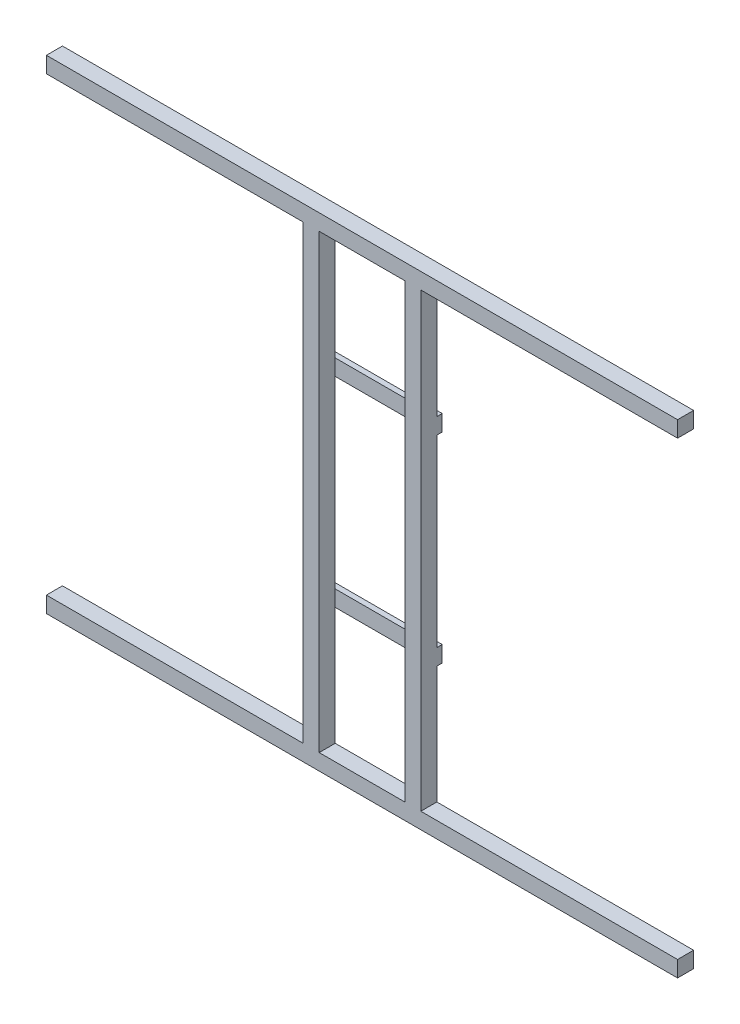
from build123d import *

# Parameters (mm, degrees)
SKETCH1_W        = 110
SKETCH1_H        = 15
EXTRUDE1_DEPTH   = 5
EXTRUDE1_2_DEPTH = 5
SKETCH2_W        = 80
SKETCH2_H        = 421.99984649
EXTRUDE2_DEPTH   = 15


with BuildPart() as part:
    # Sketch1 → Extrude1 (new body)
    with BuildSketch(Plane.XY):
        with Locations((0, 93.499923245)):
            Rectangle(SKETCH1_W, SKETCH1_H)
    extrude(amount=EXTRUDE1_DEPTH)



with BuildPart() as body_2:
    # Sketch1 → Extrude1 2 (new body)
    with BuildSketch(Plane.XY):
        with Locations((0, -93.499923245)):
            Rectangle(SKETCH1_W, SKETCH1_H)
    extrude(amount=EXTRUDE1_2_DEPTH)


with BuildPart() as part_1:
    add(part.part)

    add(body_2.part)  # Extrude2 merges body 2
    # Sketch2 → Extrude2 (add)
    with BuildSketch(Plane.XY.offset(5)):
        Polygon((55, -210.999923245), (55, 210.999923245), (295, 210.999923245), (295, 225.999923245), (-295, 225.999923245), (-295, 210.999923245), (-55, 210.999923245), (-55, -210.999923245), (-295, -210.999923245), (-295, -225.999923245), (295, -225.999923245), (295, -210.999923245), align=None)
        Rectangle(SKETCH2_W, SKETCH2_H, mode=Mode.SUBTRACT)
    extrude(amount=EXTRUDE2_DEPTH)


solid = part_1.part
